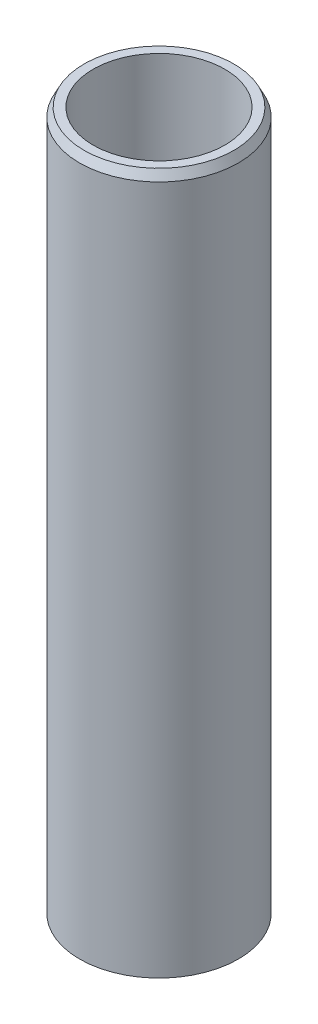
from build123d import *
from OCP.BRepFilletAPI import BRepFilletAPI_MakeChamfer

# Parameters (mm, degrees)
SKETCH1_R           = 27.5
BOSS_EXTRUDE1_DEPTH = 243.434436391
SKETCH2_R           = 22.812607547
CUT_EXTRUDE1_DEPTH  = 247.521449008
CHAMFER1_SIZE       = 3.018368135
CHAMFER1_SIZE2      = 1.545041722


with BuildPart() as part:
    # Sketch1 → Boss-Extrude1 (new body)
    with BuildSketch(Plane(origin=(0, 0, 0), x_dir=(1, 0, 0), z_dir=(0, 1, 0))):
        Circle(SKETCH1_R)
    extrude(amount=BOSS_EXTRUDE1_DEPTH)

    # Sketch2 → Cut-Extrude1 (cut, through all)
    with BuildSketch(Plane(origin=(0, 0, 0), x_dir=(1, 0, 0), z_dir=(0, 1, 0))):
        Circle(SKETCH2_R)
    extrude(amount=CUT_EXTRUDE1_DEPTH, mode=Mode.SUBTRACT)

    # Chamfer1: one chamfer whose edges measure the first distance from different faces: ONE call of the kernel's chamfer builder (chamfer() names one face for all edges)
    chamfer1_edges_1 = [part.edges().sort_by_distance(p)[0] for p in [
        (-27.5, 243.434436391, 0),
    ]]
    chamfer1_side_1 = [part.faces().sort_by_distance(p)[0] for p in [
        (-27.5, 121.717218195, 0),
    ]]
    chamfer1_edges_2 = [part.edges().sort_by_distance(p)[0] for p in [
        (-27.5, 0, 0),
    ]]
    chamfer1_side_2 = [part.faces().sort_by_distance(p)[0] for p in [
        (-26.722182541, 0, 0),
    ]]
    chamfer1 = BRepFilletAPI_MakeChamfer(part.part.solid().wrapped)
    for e in chamfer1_edges_1:
        chamfer1.Add(CHAMFER1_SIZE, CHAMFER1_SIZE2, e.wrapped, chamfer1_side_1[0].wrapped)  # the first distance lies on this face
    for e in chamfer1_edges_2:
        chamfer1.Add(CHAMFER1_SIZE, CHAMFER1_SIZE2, e.wrapped, chamfer1_side_2[0].wrapped)  # the first distance lies on this face
    add(Compound.cast(chamfer1.Shape()), mode=Mode.REPLACE)


solid = part.part
